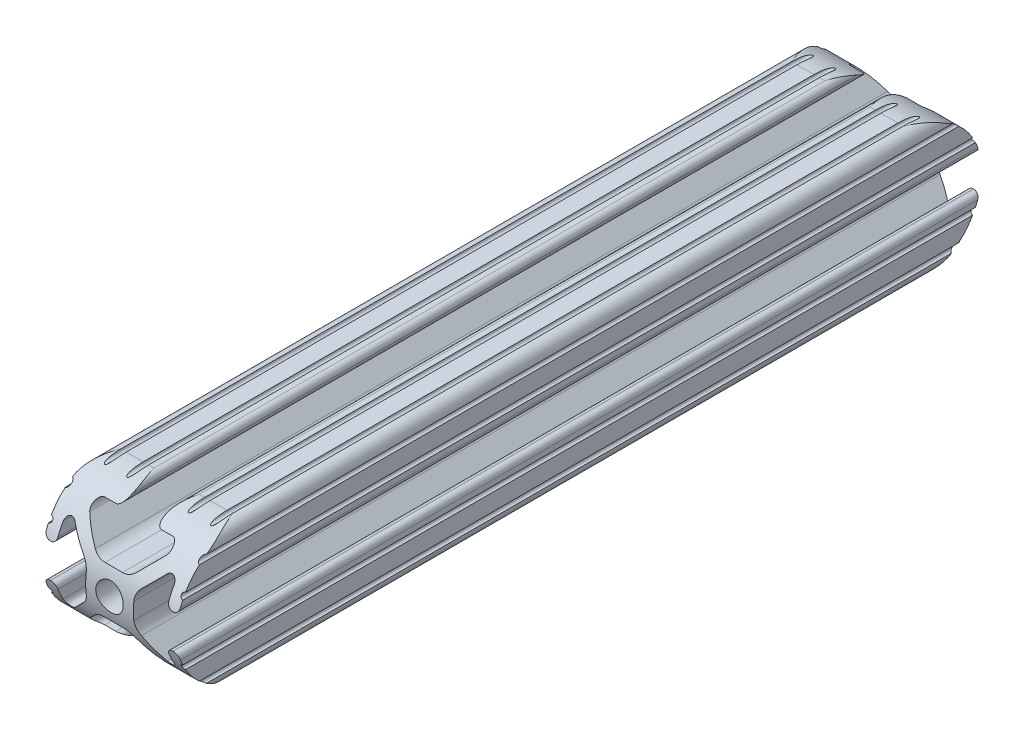
from build123d import *

# Parameters (mm, degrees)
SKETCH1_R               = 2.6035
BOSS_EXTRUDE1_DEPTH     = 76.2
CUT_EXTRUDE1_DEPTH      = 82.319677815
CUT_EXTRUDE1_DEPTH_BACK = 82.319677815
SKETCH3_R               = 3.175


with BuildPart() as part:
    # Sketch1 → Boss-Extrude1 (new, symmetric)
    with BuildSketch(Plane.XY):
        with BuildLine():
            Line((-7.179650497, -8.645192506), (-3.952270251, -5.423690499))
            ThreePointArc((-3.952270251, -5.423690499), (-2.922936451, -4.736929036), (-1.709253557, -4.4958))
            Line((-1.709253557, -4.4958), (1.709253557, -4.4958))
            ThreePointArc((1.709253557, -4.4958), (2.922936451, -4.736929036), (3.952270251, -5.423690499))
            Line((3.952270251, -5.423690499), (7.179650497, -8.645192506))
            ThreePointArc((7.179650497, -8.645192506), (7.41473083, -9.822813117), (6.416408329, -10.4902))
            Line((6.416408329, -10.4902), (4.287512407, -10.4902))
            ThreePointArc((4.287512407, -10.4902), (3.54574862, -10.79744862), (3.2385, -11.539212407))
            Line((3.2385, -11.539212407), (3.2385, -11.650987593))
            ThreePointArc((3.2385, -11.650987593), (3.54574862, -12.39275138), (4.287512407, -12.7))
            Line((4.287512407, -12.7), (5.317126718, -12.7))
            ThreePointArc((5.317126718, -12.7), (5.825126718, -12.192), (6.333126718, -12.7))
            Line((6.333126718, -12.7), (9.550443118, -12.7))
            ThreePointArc((9.550443118, -12.7), (10.058366869, -12.192000006), (10.566443095, -12.699847501))
            ThreePointArc((10.566443095, -12.699847501), (12.082537762, -12.08250727), (12.699846982, -10.566399977))
            ThreePointArc((12.699846982, -10.566399977), (12.192000006, -10.058323491), (12.7, -9.5504))
            Line((12.7, -9.5504), (12.7, -6.3330836))
            ThreePointArc((12.7, -6.3330836), (12.192, -5.8250836), (12.7, -5.3170836))
            Line((12.7, -5.3170836), (12.7, -4.287469289))
            ThreePointArc((12.7, -4.287469289), (12.39275138, -3.545705502), (11.650987593, -3.238456882))
            Line((11.650987593, -3.238456882), (11.539212407, -3.238456882))
            ThreePointArc((11.539212407, -3.238456882), (10.79744862, -3.545705502), (10.4902, -4.287469289))
            Line((10.4902, -4.287469289), (10.4902, -6.402089023))
            ThreePointArc((10.4902, -6.402089023), (9.856505071, -7.351067942), (8.737131347, -7.129408934))
            Line((8.737131347, -7.129408934), (5.441005833, -3.840816462))
            ThreePointArc((5.441005833, -3.840816462), (4.750877967, -2.809883091), (4.5085, -1.593185507))
            Line((4.5085, -1.593185507), (4.5085, 1.593185507))
            ThreePointArc((4.5085, 1.593185507), (4.750877967, 2.809883091), (5.441005833, 3.840816462))
            Line((5.441005833, 3.840816462), (8.737131347, 7.129408934))
            ThreePointArc((8.737131347, 7.129408934), (9.856505071, 7.351067942), (10.4902, 6.402089023))
            Line((10.4902, 6.402089023), (10.4902, 4.287469289))
            ThreePointArc((10.4902, 4.287469289), (10.79744862, 3.545705502), (11.539212407, 3.238456882))
            Line((11.539212407, 3.238456882), (11.650987593, 3.238456882))
            ThreePointArc((11.650987593, 3.238456882), (12.39275138, 3.545705502), (12.7, 4.287469289))
            Line((12.7, 4.287469289), (12.7, 5.3170836))
            ThreePointArc((12.7, 5.3170836), (12.192, 5.8250836), (12.7, 6.3330836))
            Line((12.7, 6.3330836), (12.7, 9.5504))
            ThreePointArc((12.7, 9.5504), (12.192000006, 10.058323491), (12.699846982, 10.566399977))
            ThreePointArc((12.699846982, 10.566399977), (12.082537762, 12.08250727), (10.566443095, 12.699847501))
            ThreePointArc((10.566443095, 12.699847501), (10.058366869, 12.192000006), (9.550443118, 12.7))
            Line((9.550443118, 12.7), (6.333126718, 12.7))
            ThreePointArc((6.333126718, 12.7), (5.825126718, 12.192), (5.317126718, 12.7))
            Line((5.317126718, 12.7), (4.287512407, 12.7))
            ThreePointArc((4.287512407, 12.7), (3.54574862, 12.39275138), (3.2385, 11.650987593))
            Line((3.2385, 11.650987593), (3.2385, 11.539212407))
            ThreePointArc((3.2385, 11.539212407), (3.54574862, 10.79744862), (4.287512407, 10.4902))
            Line((4.287512407, 10.4902), (6.476788598, 10.4902))
            ThreePointArc((6.476788598, 10.4902), (7.432222385, 9.85140422), (7.207036008, 8.724370562))
            Line((7.207036008, 8.724370562), (3.898272566, 5.423169045))
            ThreePointArc((3.898272566, 5.423169045), (2.869120213, 4.736787962), (1.655778399, 4.4958))
            Line((1.655778399, 4.4958), (-1.655778399, 4.4958))
            ThreePointArc((-1.655778399, 4.4958), (-2.869120213, 4.736787962), (-3.898272566, 5.423169045))
            Line((-3.898272566, 5.423169045), (-7.207036008, 8.724370562))
            ThreePointArc((-7.207036008, 8.724370562), (-7.432222385, 9.85140422), (-6.476788598, 10.4902))
            Line((-6.476788598, 10.4902), (-4.287512407, 10.4902))
            ThreePointArc((-4.287512407, 10.4902), (-3.54574862, 10.79744862), (-3.2385, 11.539212407))
            Line((-3.2385, 11.539212407), (-3.2385, 11.650987593))
            ThreePointArc((-3.2385, 11.650987593), (-3.54574862, 12.39275138), (-4.287512407, 12.7))
            Line((-4.287512407, 12.7), (-5.317126718, 12.7))
            ThreePointArc((-5.317126718, 12.7), (-5.825126718, 12.192), (-6.333126718, 12.7))
            Line((-6.333126718, 12.7), (-9.550443118, 12.7))
            ThreePointArc((-9.550443118, 12.7), (-10.058366869, 12.192000006), (-10.566443095, 12.699847501))
            ThreePointArc((-10.566443095, 12.699847501), (-12.082537762, 12.08250727), (-12.699846982, 10.566399977))
            ThreePointArc((-12.699846982, 10.566399977), (-12.192000006, 10.058323491), (-12.7, 9.5504))
            Line((-12.7, 9.5504), (-12.7, 6.3330836))
            ThreePointArc((-12.7, 6.3330836), (-12.192, 5.8250836), (-12.7, 5.3170836))
            Line((-12.7, 5.3170836), (-12.7, 4.287469289))
            ThreePointArc((-12.7, 4.287469289), (-12.39275138, 3.545705502), (-11.650987593, 3.238456882))
            Line((-11.650987593, 3.238456882), (-11.539212407, 3.238456882))
            ThreePointArc((-11.539212407, 3.238456882), (-10.79744862, 3.545705502), (-10.4902, 4.287469289))
            Line((-10.4902, 4.287469289), (-10.4902, 6.402089023))
            ThreePointArc((-10.4902, 6.402089023), (-9.856505071, 7.351067942), (-8.737131347, 7.129408934))
            Line((-8.737131347, 7.129408934), (-5.441005833, 3.840816462))
            ThreePointArc((-5.441005833, 3.840816462), (-4.750877967, 2.809883091), (-4.5085, 1.593185507))
            Line((-4.5085, 1.593185507), (-4.5085, -1.593185507))
            ThreePointArc((-4.5085, -1.593185507), (-4.750877967, -2.809883091), (-5.441005833, -3.840816462))
            Line((-5.441005833, -3.840816462), (-8.737131347, -7.129408934))
            ThreePointArc((-8.737131347, -7.129408934), (-9.856505071, -7.351067942), (-10.4902, -6.402089023))
            Line((-10.4902, -6.402089023), (-10.4902, -4.287469289))
            ThreePointArc((-10.4902, -4.287469289), (-10.79744862, -3.545705502), (-11.539212407, -3.238456882))
            Line((-11.539212407, -3.238456882), (-11.650987593, -3.238456882))
            ThreePointArc((-11.650987593, -3.238456882), (-12.39275138, -3.545705502), (-12.7, -4.287469289))
            Line((-12.7, -4.287469289), (-12.7, -5.3170836))
            ThreePointArc((-12.7, -5.3170836), (-12.192, -5.8250836), (-12.7, -6.3330836))
            Line((-12.7, -6.3330836), (-12.7, -9.5504))
            ThreePointArc((-12.7, -9.5504), (-12.192000006, -10.058323491), (-12.699846982, -10.566399977))
            ThreePointArc((-12.699846982, -10.566399977), (-12.082537762, -12.08250727), (-10.566443095, -12.699847501))
            ThreePointArc((-10.566443095, -12.699847501), (-10.058366869, -12.192000006), (-9.550443118, -12.7))
            Line((-9.550443118, -12.7), (-6.333126718, -12.7))
            ThreePointArc((-6.333126718, -12.7), (-5.825126718, -12.192), (-5.317126718, -12.7))
            Line((-5.317126718, -12.7), (-4.287512407, -12.7))
            ThreePointArc((-4.287512407, -12.7), (-3.54574862, -12.39275138), (-3.2385, -11.650987593))
            Line((-3.2385, -11.650987593), (-3.2385, -11.539212407))
            ThreePointArc((-3.2385, -11.539212407), (-3.54574862, -10.79744862), (-4.287512407, -10.4902))
            Line((-4.287512407, -10.4902), (-6.416408329, -10.4902))
            ThreePointArc((-6.416408329, -10.4902), (-7.41473083, -9.822813117), (-7.179650497, -8.645192506))
        make_face()
        Circle(SKETCH1_R, mode=Mode.SUBTRACT)
    extrude(amount=BOSS_EXTRUDE1_DEPTH, both=True)

    # Sketch3 → Cut-Extrude1 (cut, two sides: drawn at the far end of the back side and taken through both)
    with BuildSketch(Plane(origin=(12.7, 0, 0), x_dir=(0, 0, -1), z_dir=(1, 0, 0)).offset(-CUT_EXTRUDE1_DEPTH_BACK)):
        with Locations((-63.5, 0)):
            Circle(SKETCH3_R)
        with Locations((-38.1, 0)):
            Circle(SKETCH3_R)
        with BuildLine():
            Line((-76.2, -12.7), (-63.5, -12.7))
            ThreePointArc((-63.5, -12.7), (-72.480256121, -8.980256121), (-76.2, 0))
            Line((-76.2, 0), (-76.2, -12.7))
        make_face()
        with BuildLine():
            ThreePointArc((-76.2, 0), (-72.480256121, 8.980256121), (-63.5, 12.7))
            Line((-63.5, 12.7), (-76.2, 12.7))
            Line((-76.2, 12.7), (-76.2, 0))
        make_face()
        with BuildLine():
            ThreePointArc((76.2, 0), (72.480256093, -8.980256149), (63.499999921, -12.7))
            Line((63.499999921, -12.7), (76.2, -12.7))
            Line((76.2, -12.7), (76.2, 0))
        make_face()
        with BuildLine():
            Line((76.2, 0), (76.2, 12.7))
            Line((76.2, 12.7), (63.500000056, 12.7))
            ThreePointArc((63.500000056, 12.7), (72.480256141, 8.980256101), (76.2, 0))
        make_face()
    extrude(amount=CUT_EXTRUDE1_DEPTH + CUT_EXTRUDE1_DEPTH_BACK, mode=Mode.SUBTRACT)


solid = part.part
